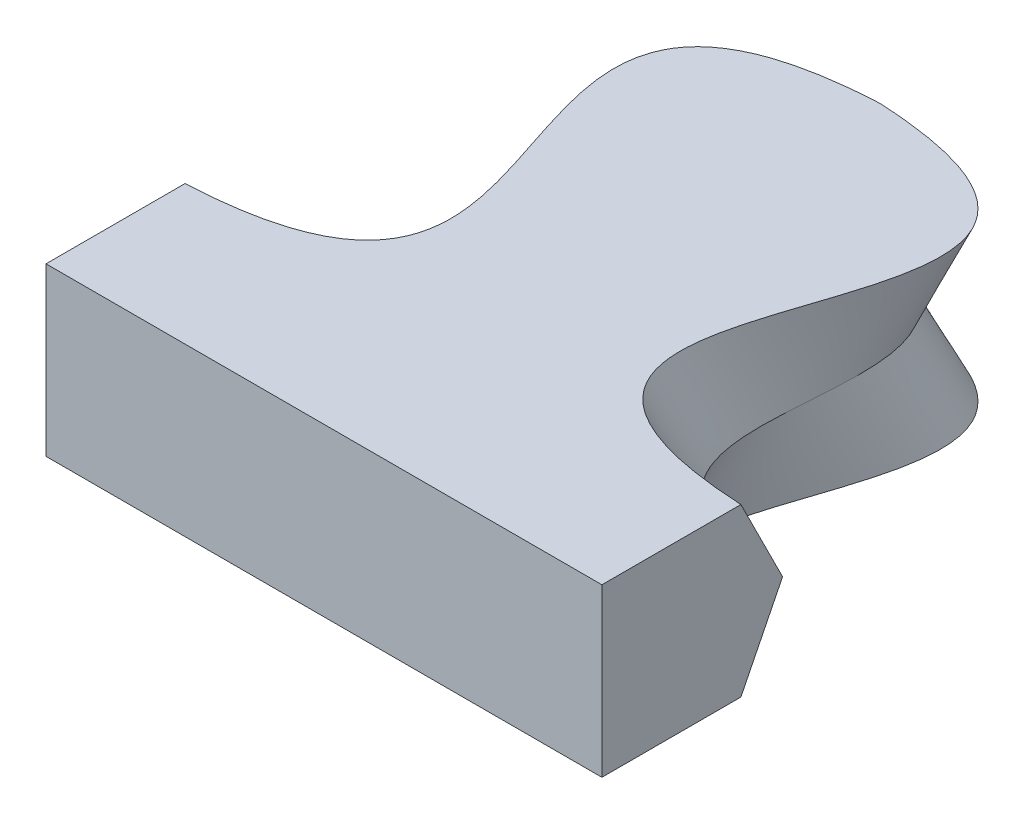
from build123d import *


# Read off the part's stored shape, not the designer's step: Mirror2
with BuildPart() as part:
    # Sketch1 → Loft1 section 0
    with BuildSketch(Plane(origin=(0, 0, 0), x_dir=(1, 0, 0), z_dir=(0, 1, 0))):
        with BuildLine():
            Line((0, 0), (2, 0))
            Line((2, 0), (2, 1))
            add(Edge.make_bspline(
                [(0, 4), (2.939621294, 3.853681673), (-0.939621294, 1.146318327), (2, 1)],
                knots=[0, 0, 0, 0, 1, 1, 1, 1], degree=3))
            Line((0, 4), (0, 0))
        make_face()
    # Sketch2 → Loft1 section 1
    with BuildSketch(Plane(origin=(0, 0.6, 0), x_dir=(1, 0, 0), z_dir=(0, 1, 0))):
        with BuildLine():
            Line((0, 0), (2, 0))
            Line((2, 0), (2, 1.3))
            add(Edge.make_bspline(
                [(0, 3.7), (2.166666667, 3.7), (-0.166666667, 1.3), (2, 1.3)],
                knots=[0, 0, 0, 0, 1, 1, 1, 1], degree=3))
            Line((0, 3.7), (0, 0))
        make_face()
    loft1 = loft()

    # Mirror1: Loft1 across plane
    add(loft1.mirror(Plane.ZX.offset(0.6)))

    # Mirror2: part across plane


with BuildPart() as part_1:
    add(part.part)
    add(part.part.mirror(Plane(origin=(0, 0, 0), x_dir=(0, 0, 1), z_dir=(1, 0, 0))))


solid = part_1.part
